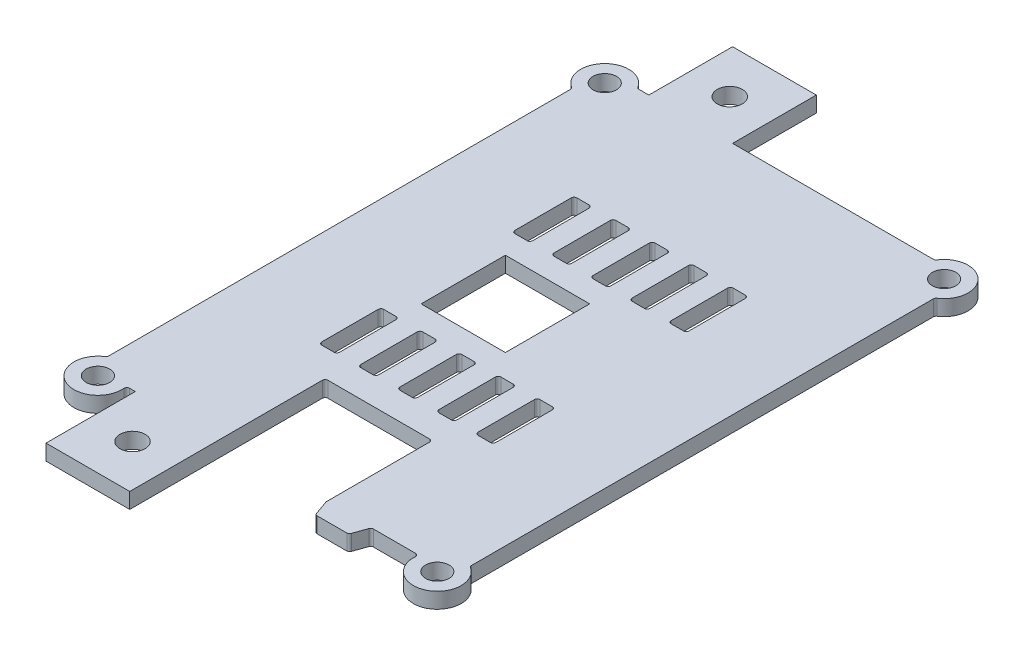
from build123d import *

# Parameters (mm, degrees)
BASEPLATE_OUTLINE_R = 2.1
BASEPLATE_DEPTH     = 2.8
CUT_EXTRUDE1_REACH  = 115.438
SKETCH3_W           = 19.2
SKETCH3_H           = 19.147905432
SKETCH3_W_2         = 15.1
SKETCH3_H_2         = 15.1
SKETCH3_W_3         = 3.2
SKETCH3_H_3         = 11.1
FILLET1_R           = 0.5
SKETCH4_W           = 15
SKETCH4_H           = 35
SKETCH4_R           = 2.25
SKETCH4_H_2         = 15
BOSS_EXTRUDE1_DEPTH = 2.8


# Read off the part's stored shape, not the designer's step: BasePlate
with BuildPart() as part:
    # BasePlate outline → BasePlate (new body)
    with BuildSketch(Plane(origin=(0, 0, 0), x_dir=(1, 0, 0), z_dir=(0, 1, 0))):
        with BuildLine():
            Line((43.502626614, -5.852332608), (48.792614178, -5.852332608))
            ThreePointArc((48.792614178, -5.852332608), (49.082078508, -5.760021707), (49.264659986, -5.517174213))
            Line((49.264659986, -5.517174213), (50.078201202, -3.187491002))
            ThreePointArc((50.078201202, -3.187491002), (50.26078268, -2.944643509), (50.55024701, -2.852332608))
            Line((50.55024701, -2.852332608), (58.116695703, -2.852332608))
            ThreePointArc((58.116695703, -2.852332608), (58.484685739, -3.013831008), (58.614956567, -3.393999275))
            ThreePointArc((58.614956567, -3.393999275), (64.799237397, -7.61016844), (65.229166667, -0.137781095))
            ThreePointArc((65.229166667, -0.137781095), (65.061014427, 0.043158816), (65, 0.282515593))
            Line((65, 0.282515593), (65, 83.012819192))
            ThreePointArc((65, 83.012819192), (65.061014427, 83.252175969), (65.229166667, 83.433115879))
            ThreePointArc((65.229166667, 83.433115879), (65.940559159, 90.088226551), (59.285448487, 89.376834059))
            ThreePointArc((59.285448487, 89.376834059), (59.104508577, 89.208681819), (58.8651518, 89.147667392))
            Line((58.8651518, 89.147667392), (6.1348482, 89.147667392))
            ThreePointArc((6.1348482, 89.147667392), (5.895491423, 89.208681819), (5.714551513, 89.376834059))
            ThreePointArc((5.714551513, 89.376834059), (-0.940559159, 90.088226551), (-0.229166667, 83.433115879))
            ThreePointArc((-0.229166667, 83.433115879), (-0.061014427, 83.252175969), (0, 83.012819192))
            Line((0, 83.012819192), (0, 0.282515593))
            ThreePointArc((0, 0.282515593), (-0.061014427, 0.043158816), (-0.229166667, -0.137781095))
            ThreePointArc((-0.229166667, -0.137781095), (0.200762603, -7.61016844), (6.385043433, -3.393999275))
            ThreePointArc((6.385043433, -3.393999275), (6.515314261, -3.013831008), (6.883304297, -2.852332608))
            Line((6.883304297, -2.852332608), (14.44975299, -2.852332608))
            ThreePointArc((14.44975299, -2.852332608), (14.73921732, -2.944643509), (14.921798798, -3.187491002))
            Line((14.921798798, -3.187491002), (15.735340014, -5.517174213))
            ThreePointArc((15.735340014, -5.517174213), (15.917921492, -5.760021707), (16.207385822, -5.852332608))
            Line((16.207385822, -5.852332608), (21.497373386, -5.852332608))
            ThreePointArc((21.497373386, -5.852332608), (21.786837716, -5.760021707), (21.969419194, -5.517174213))
            Line((21.969419194, -5.517174213), (22.78296041, -3.187491002))
            ThreePointArc((22.78296041, -3.187491002), (22.965541888, -2.944643509), (23.255006218, -2.852332608))
            Line((23.255006218, -2.852332608), (41.744993782, -2.852332608))
            ThreePointArc((41.744993782, -2.852332608), (42.034458112, -2.944643509), (42.21703959, -3.187491002))
            Line((42.21703959, -3.187491002), (43.030580806, -5.517174213))
            ThreePointArc((43.030580806, -5.517174213), (43.213162284, -5.760021707), (43.502626614, -5.852332608))
        make_face()
        with Locations((2.1, -3.752332608)):
            Circle(BASEPLATE_OUTLINE_R, mode=Mode.SUBTRACT)
        with Locations((62.9, -3.752332608)):
            Circle(BASEPLATE_OUTLINE_R, mode=Mode.SUBTRACT)
        with Locations((2.1, 87.047667392)):
            Circle(BASEPLATE_OUTLINE_R, mode=Mode.SUBTRACT)
        with Locations((62.9, 87.047667392)):
            Circle(BASEPLATE_OUTLINE_R, mode=Mode.SUBTRACT)
    extrude(amount=BASEPLATE_DEPTH)

    # Sketch3 → Cut-Extrude1 (cut, up to next)
    with BuildSketch(Plane(origin=(0, 2.8, 0), x_dir=(1, 0, 0), z_dir=(0, 1, 0)), mode=Mode.PRIVATE) as cut_extrude1_sk1:
        with Locations((32.5, 6.573714676)):
            Rectangle(SKETCH3_W, SKETCH3_H)
    cut_extrude1_tool1 = extrude(cut_extrude1_sk1.sketch, amount=-CUT_EXTRUDE1_REACH, mode=Mode.PRIVATE) & part.part
    # Sketch3 → Cut-Extrude1 (cut, up to next)
    with BuildSketch(Plane(origin=(0, 2.8, 0), x_dir=(1, 0, 0), z_dir=(0, 1, 0)), mode=Mode.PRIVATE) as cut_extrude1_sk2:
        with Locations((27.45, 43.897667392)):
            Rectangle(SKETCH3_W_2, SKETCH3_H_2)
    cut_extrude1_tool2 = extrude(cut_extrude1_sk2.sketch, amount=-CUT_EXTRUDE1_REACH, mode=Mode.PRIVATE) & part.part
    # Sketch3 → Cut-Extrude1 (cut, up to next)
    with BuildSketch(Plane(origin=(0, 2.8, 0), x_dir=(1, 0, 0), z_dir=(0, 1, 0)), mode=Mode.PRIVATE) as cut_extrude1_sk3:
        with Locations((32.5, 26.597667392)):
            Rectangle(SKETCH3_W_3, SKETCH3_H_3)
    cut_extrude1_tool3 = extrude(cut_extrude1_sk3.sketch, amount=-CUT_EXTRUDE1_REACH, mode=Mode.PRIVATE) & part.part
    # Sketch3 → Cut-Extrude1 (cut, up to next)
    with BuildSketch(Plane(origin=(0, 2.8, 0), x_dir=(1, 0, 0), z_dir=(0, 1, 0)), mode=Mode.PRIVATE) as cut_extrude1_sk4:
        with Locations((18.5, 26.597667392)):
            Rectangle(SKETCH3_W_3, SKETCH3_H_3)
    cut_extrude1_tool4 = extrude(cut_extrude1_sk4.sketch, amount=-CUT_EXTRUDE1_REACH, mode=Mode.PRIVATE) & part.part
    # Sketch3 → Cut-Extrude1 (cut, up to next)
    with BuildSketch(Plane(origin=(0, 2.8, 0), x_dir=(1, 0, 0), z_dir=(0, 1, 0)), mode=Mode.PRIVATE) as cut_extrude1_sk5:
        with Locations((39.5, 26.597667392)):
            Rectangle(SKETCH3_W_3, SKETCH3_H_3)
    cut_extrude1_tool5 = extrude(cut_extrude1_sk5.sketch, amount=-CUT_EXTRUDE1_REACH, mode=Mode.PRIVATE) & part.part
    # Sketch3 → Cut-Extrude1 (cut, up to next)
    with BuildSketch(Plane(origin=(0, 2.8, 0), x_dir=(1, 0, 0), z_dir=(0, 1, 0)), mode=Mode.PRIVATE) as cut_extrude1_sk6:
        with Locations((46.5, 26.597667392)):
            Rectangle(SKETCH3_W_3, SKETCH3_H_3)
    cut_extrude1_tool6 = extrude(cut_extrude1_sk6.sketch, amount=-CUT_EXTRUDE1_REACH, mode=Mode.PRIVATE) & part.part
    # Sketch3 → Cut-Extrude1 (cut, up to next)
    with BuildSketch(Plane(origin=(0, 2.8, 0), x_dir=(1, 0, 0), z_dir=(0, 1, 0)), mode=Mode.PRIVATE) as cut_extrude1_sk7:
        with Locations((25.5, 26.597667392)):
            Rectangle(SKETCH3_W_3, SKETCH3_H_3)
    cut_extrude1_tool7 = extrude(cut_extrude1_sk7.sketch, amount=-CUT_EXTRUDE1_REACH, mode=Mode.PRIVATE) & part.part
    # Sketch3 → Cut-Extrude1 (cut, up to next)
    with BuildSketch(Plane(origin=(0, 2.8, 0), x_dir=(1, 0, 0), z_dir=(0, 1, 0)), mode=Mode.PRIVATE) as cut_extrude1_sk8:
        with Locations((18.5, 61.197667392)):
            Rectangle(SKETCH3_W_3, SKETCH3_H_3)
    cut_extrude1_tool8 = extrude(cut_extrude1_sk8.sketch, amount=-CUT_EXTRUDE1_REACH, mode=Mode.PRIVATE) & part.part
    # Sketch3 → Cut-Extrude1 (cut, up to next)
    with BuildSketch(Plane(origin=(0, 2.8, 0), x_dir=(1, 0, 0), z_dir=(0, 1, 0)), mode=Mode.PRIVATE) as cut_extrude1_sk9:
        with Locations((32.5, 61.197667392)):
            Rectangle(SKETCH3_W_3, SKETCH3_H_3)
    cut_extrude1_tool9 = extrude(cut_extrude1_sk9.sketch, amount=-CUT_EXTRUDE1_REACH, mode=Mode.PRIVATE) & part.part
    # Sketch3 → Cut-Extrude1 (cut, up to next)
    with BuildSketch(Plane(origin=(0, 2.8, 0), x_dir=(1, 0, 0), z_dir=(0, 1, 0)), mode=Mode.PRIVATE) as cut_extrude1_sk10:
        with Locations((39.5, 61.197667392)):
            Rectangle(SKETCH3_W_3, SKETCH3_H_3)
    cut_extrude1_tool10 = extrude(cut_extrude1_sk10.sketch, amount=-CUT_EXTRUDE1_REACH, mode=Mode.PRIVATE) & part.part
    # Sketch3 → Cut-Extrude1 (cut, up to next)
    with BuildSketch(Plane(origin=(0, 2.8, 0), x_dir=(1, 0, 0), z_dir=(0, 1, 0)), mode=Mode.PRIVATE) as cut_extrude1_sk11:
        with Locations((46.5, 61.197667392)):
            Rectangle(SKETCH3_W_3, SKETCH3_H_3)
    cut_extrude1_tool11 = extrude(cut_extrude1_sk11.sketch, amount=-CUT_EXTRUDE1_REACH, mode=Mode.PRIVATE) & part.part
    # Sketch3 → Cut-Extrude1 (cut, up to next)
    with BuildSketch(Plane(origin=(0, 2.8, 0), x_dir=(1, 0, 0), z_dir=(0, 1, 0)), mode=Mode.PRIVATE) as cut_extrude1_sk12:
        with Locations((25.5, 61.197667392)):
            Rectangle(SKETCH3_W_3, SKETCH3_H_3)
    cut_extrude1_tool12 = extrude(cut_extrude1_sk12.sketch, amount=-CUT_EXTRUDE1_REACH, mode=Mode.PRIVATE) & part.part
    add(cut_extrude1_tool1.solids().sort_by_distance((32.5, 2.8, -6.573715))[0], mode=Mode.SUBTRACT)
    add(cut_extrude1_tool2.solids().sort_by_distance((27.45, 2.8, -43.897667))[0], mode=Mode.SUBTRACT)
    add(cut_extrude1_tool3.solids().sort_by_distance((32.5, 2.8, -26.597667))[0], mode=Mode.SUBTRACT)
    add(cut_extrude1_tool4.solids().sort_by_distance((18.5, 2.8, -26.597667))[0], mode=Mode.SUBTRACT)
    add(cut_extrude1_tool5.solids().sort_by_distance((39.5, 2.8, -26.597667))[0], mode=Mode.SUBTRACT)
    add(cut_extrude1_tool6.solids().sort_by_distance((46.5, 2.8, -26.597667))[0], mode=Mode.SUBTRACT)
    add(cut_extrude1_tool7.solids().sort_by_distance((25.5, 2.8, -26.597667))[0], mode=Mode.SUBTRACT)
    add(cut_extrude1_tool8.solids().sort_by_distance((18.5, 2.8, -61.197667))[0], mode=Mode.SUBTRACT)
    add(cut_extrude1_tool9.solids().sort_by_distance((32.5, 2.8, -61.197667))[0], mode=Mode.SUBTRACT)
    add(cut_extrude1_tool10.solids().sort_by_distance((39.5, 2.8, -61.197667))[0], mode=Mode.SUBTRACT)
    add(cut_extrude1_tool11.solids().sort_by_distance((46.5, 2.8, -61.197667))[0], mode=Mode.SUBTRACT)
    add(cut_extrude1_tool12.solids().sort_by_distance((25.5, 2.8, -61.197667))[0], mode=Mode.SUBTRACT)

    # Fillet1
    fillet1_edges = [part.edges().sort_by_distance(p)[0] for p in [
        (22.9, 1.4, -16.147667392),
        (42.1, 1.4, -16.147667392),
        (37.9, 1.4, -55.647667392),
        (37.9, 1.4, -66.747667392),
        (41.1, 1.4, -66.747667392),
        (41.1, 1.4, -55.647667392),
        (16.9, 1.4, -66.747667392),
        (20.1, 1.4, -66.747667392),
        (20.1, 1.4, -55.647667392),
        (16.9, 1.4, -55.647667392),
        (27.1, 1.4, -66.747667392),
        (27.1, 1.4, -55.647667392),
        (23.9, 1.4, -55.647667392),
        (23.9, 1.4, -66.747667392),
        (30.9, 1.4, -21.047667392),
        (30.9, 1.4, -32.147667392),
        (34.1, 1.4, -32.147667392),
        (34.1, 1.4, -21.047667392),
        (44.9, 1.4, -21.047667392),
        (44.9, 1.4, -32.147667392),
        (48.1, 1.4, -32.147667392),
        (48.1, 1.4, -21.047667392),
        (37.9, 1.4, -21.047667392),
        (37.9, 1.4, -32.147667392),
        (41.1, 1.4, -32.147667392),
        (41.1, 1.4, -21.047667392),
        (16.9, 1.4, -32.147667392),
        (20.1, 1.4, -32.147667392),
        (20.1, 1.4, -21.047667392),
        (16.9, 1.4, -21.047667392),
        (27.1, 1.4, -32.147667392),
        (27.1, 1.4, -21.047667392),
        (23.9, 1.4, -21.047667392),
        (23.9, 1.4, -32.147667392),
        (30.9, 1.4, -55.647667392),
        (30.9, 1.4, -66.747667392),
        (34.1, 1.4, -66.747667392),
        (34.1, 1.4, -55.647667392),
        (44.9, 1.4, -55.647667392),
        (44.9, 1.4, -66.747667392),
        (48.1, 1.4, -66.747667392),
        (48.1, 1.4, -55.647667392),
    ]]
    fillet(fillet1_edges, radius=FILLET1_R)

    # Sketch4 → Boss-Extrude1 (add)
    # profile 1 of 2: a face of its own
    with BuildSketch(Plane(origin=(0, 2.8, 0), x_dir=(1, 0, 0), z_dir=(0, 1, 0))):
        with Locations((15.4, -1.352332608)):
            Rectangle(SKETCH4_W, SKETCH4_H)
        with Locations(Location((15.4, -10.852332608, 0), (0, 0, 270))):
            Circle(SKETCH4_R, mode=Mode.SUBTRACT)
    # profile 2 of 2: a face of its own
    with BuildSketch(Plane(origin=(0, 2.8, 0), x_dir=(1, 0, 0), z_dir=(0, 1, 0))):
        with Locations((15.4, 96.647667392)):
            Rectangle(SKETCH4_W, SKETCH4_H_2)
        with Locations(Location((15.4, 96.147667392, 0), (0, 0, 270))):
            Circle(SKETCH4_R, mode=Mode.SUBTRACT)
    extrude(amount=-BOSS_EXTRUDE1_DEPTH)


solid = part.part
